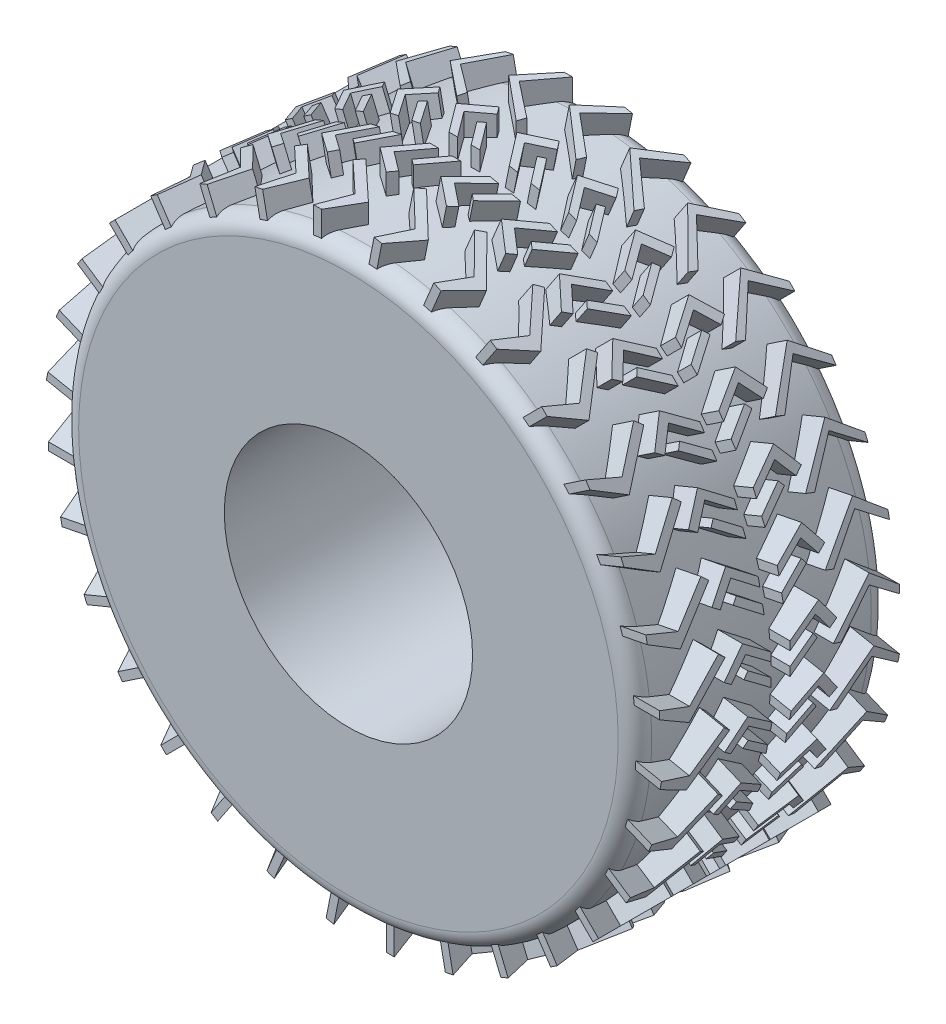
from build123d import *

# Parameters (mm, degrees)
SKETCH1_R                = 60
SKETCH1_R_2              = 26
BOSS_EXTRUDE2_DEPTH      = 26.5
FILLET2_R                = 3.5
BOSS_EXTRUDE3_REACH      = 142.279
BOSS_EXTRUDE3_END_RADIUS = 26
CIRPATTERN1_COUNT        = 32


with BuildPart() as part:
    # Sketch1 → Boss-Extrude2 (new, symmetric)
    with BuildSketch(Plane.XY):
        Circle(SKETCH1_R)
        Circle(SKETCH1_R_2, mode=Mode.SUBTRACT)
    extrude(amount=BOSS_EXTRUDE2_DEPTH, both=True)

    # Fillet2
    fillet2_edges = [part.edges().sort_by_distance(p)[0] for p in [
        (-60, 0, -26.5),
        (-60, 0, 26.5),
    ]]
    fillet(fillet2_edges, radius=FILLET2_R)

    # Boss-Extrude3: up to this cylinder (the profile starts outside it)
    boss_extrude3_end = Plane(origin=(0, 0, 1.6602895), z_dir=(0, 0, -1)) * Cylinder(BOSS_EXTRUDE3_END_RADIUS, 384.584487, mode=Mode.PRIVATE)
    # Sketch2 → Boss-Extrude3 (add, up to the surface)
    with BuildSketch(Plane(origin=(0, 64, 0), x_dir=(1, 0, 0), z_dir=(0, 1, 0)), mode=Mode.PRIVATE) as boss_extrude3_sk1:
        Polygon((-5.635334326, -2), (-7.42911994, -2), (-11.904554859, -7.963945184), (-6.779635572, -11.809762345), (-5.651878544, -10.306918215), (-9.629232538, -7.322251454), align=None)
    boss_extrude3_tool1 = extrude(boss_extrude3_sk1.sketch, amount=-BOSS_EXTRUDE3_REACH, mode=Mode.PRIVATE) - boss_extrude3_end
    # Sketch2 → Boss-Extrude3 (add, up to the surface)
    with BuildSketch(Plane(origin=(0, 64, 0), x_dir=(1, 0, 0), z_dir=(0, 1, 0)), mode=Mode.PRIVATE) as boss_extrude3_sk2:
        Polygon((-11.904554859, 7.963945184), (-7.42911994, 2), (-5.635334326, 2), (-9.629232538, 7.322251454), (-5.651878544, 10.306918215), (-6.779635572, 11.809762345), align=None)
    boss_extrude3_tool2 = extrude(boss_extrude3_sk2.sketch, amount=-BOSS_EXTRUDE3_REACH, mode=Mode.PRIVATE) - boss_extrude3_end
    # Sketch2 → Boss-Extrude3 (add, up to the surface)
    with BuildSketch(Plane(origin=(0, 64, 0), x_dir=(1, 0, 0), z_dir=(0, 1, 0)), mode=Mode.PRIVATE) as boss_extrude3_sk3:
        Polygon((-6.4017376, 6.800284974), (-2.799554547, 2.000031443), (-0.968182843, 2.000031443), (-5.230126797, 7.679479491), align=None)
    boss_extrude3_tool3 = extrude(boss_extrude3_sk3.sketch, amount=-BOSS_EXTRUDE3_REACH, mode=Mode.PRIVATE) - boss_extrude3_end
    # Sketch2 → Boss-Extrude3 (add, up to the surface)
    with BuildSketch(Plane(origin=(0, 64, 0), x_dir=(1, 0, 0), z_dir=(0, 1, 0)), mode=Mode.PRIVATE) as boss_extrude3_sk4:
        Polygon((-8.434773521, -25.339699476), (-6.779635572, -25.339699476), (-3.176718879, -19.135228932), (-11.239116334, -11.612386375), (-12.540104862, -13.006684676), (-6.070097904, -19.043703313), align=None)
    boss_extrude3_tool4 = extrude(boss_extrude3_sk4.sketch, amount=-BOSS_EXTRUDE3_REACH, mode=Mode.PRIVATE) - boss_extrude3_end
    # Sketch2 → Boss-Extrude3 (add, up to the surface)
    with BuildSketch(Plane(origin=(0, 64, 0), x_dir=(1, 0, 0), z_dir=(0, 1, 0)), mode=Mode.PRIVATE) as boss_extrude3_sk5:
        Polygon((-5.230126797, -7.679479491), (-0.968182843, -2.000031443), (-2.799554547, -2.000031443), (-6.4017376, -6.800284974), align=None)
    boss_extrude3_tool5 = extrude(boss_extrude3_sk5.sketch, amount=-BOSS_EXTRUDE3_REACH, mode=Mode.PRIVATE) - boss_extrude3_end
    # Sketch2 → Boss-Extrude3 (add, up to the surface)
    with BuildSketch(Plane(origin=(0, 64, 0), x_dir=(1, 0, 0), z_dir=(0, 1, 0)), mode=Mode.PRIVATE) as boss_extrude3_sk6:
        Polygon((-9.303540016, 18.570297549), (-4.509544914, 24.932428976), (-6.214376018, 24.932428976), (-11.487869581, 18.553348457), (-2.42726866, 11.063080779), (-1.864146257, 12.720267519), align=None)
    boss_extrude3_tool6 = extrude(boss_extrude3_sk6.sketch, amount=-BOSS_EXTRUDE3_REACH, mode=Mode.PRIVATE) - boss_extrude3_end
    boss_extrude3 = boss_extrude3_tool1.solids().sort_by_distance((-6.532227, 64, 2.116419))[0] + boss_extrude3_tool2.solids().sort_by_distance((-9.573721, 64, -5.051849))[0] + boss_extrude3_tool3.solids().sort_by_distance((-3.828906, 64, -4.626104))[0] + boss_extrude3_tool4.solids().sort_by_distance((-7.607205, 64, 25.173533))[0] + boss_extrude3_tool5.solids().sort_by_distance((-3.828906, 64, 4.626104))[0] + boss_extrude3_tool6.solids().sort_by_distance((-7.041364, 64, -21.852954))[0]
    add(boss_extrude3)

    # CirPattern1: Boss-Extrude3 ×32 about axis
    cirpattern1_axis = Axis((0, 0, 26.5), (0, 0, -1))
    for i in range(1, CIRPATTERN1_COUNT):
        add(boss_extrude3.rotate(cirpattern1_axis, i * 360 / CIRPATTERN1_COUNT))


solid = part.part
